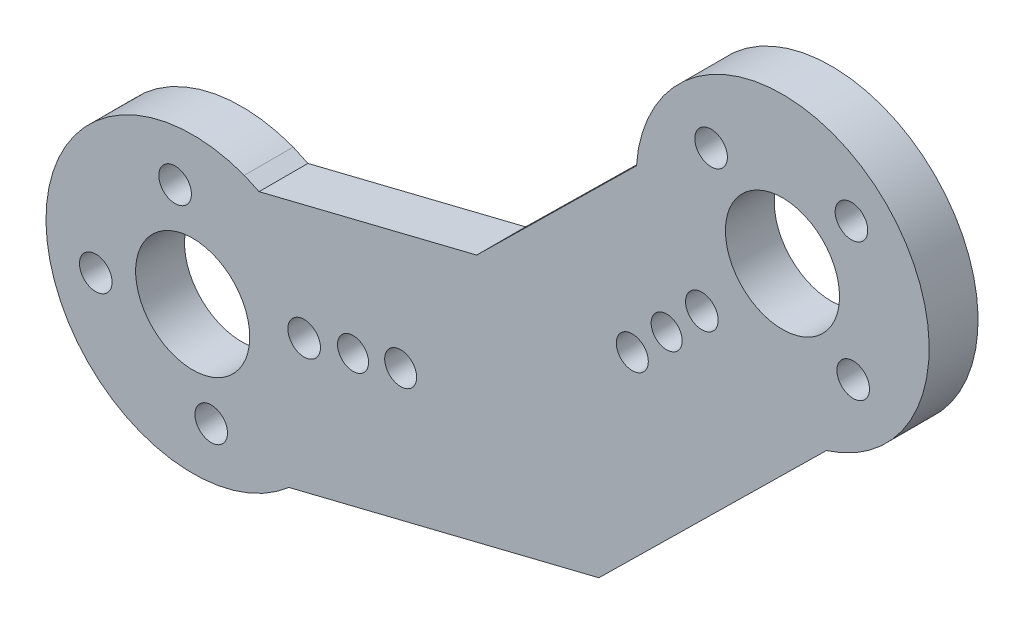
from build123d import *

# Parameters (mm, degrees)
SKETCH1_R       = 1
SKETCH1_R_2     = 3.5
SKETCH1_R_3     = 0.952573724
SKETCH1_R_4     = 0.980307261
EXTRUDE_6_DEPTH = 3


with BuildPart() as part:
    # Sketch1 → Бобышка-Вытянуть6 (new body)
    with BuildSketch(Plane.XY):
        with BuildLine():
            Line((-50.090575528, 20.246358773), (-63.443383911, 16.939772721))
            Line((-63.443383911, 16.939772721), (-64.348156071, 17.355557159))
            ThreePointArc((-64.348156071, 17.355557159), (-76.371742075, 7.335892912), (-61.608311767, 2.139604087))
            Line((-61.608311767, 2.139604087), (-42.594837437, 6.847953613))
            Line((-42.594837437, 6.847953613), (-28.633720832, 20.587239783))
            ThreePointArc((-28.633720832, 20.587239783), (-25.336971544, 35.887296519), (-40.166847554, 30.883790793))
            Line((-40.166847554, 30.883790793), (-40.285943738, 29.895203185))
            Line((-40.285943738, 29.895203185), (-50.090575528, 20.246358773))
        make_face()
        with Locations((-27.098820281, 33.552896146)):
            Circle(SKETCH1_R, mode=Mode.SUBTRACT)
        with Locations((-67.514190904, 8.930818383)):
            Circle(SKETCH1_R_2, mode=Mode.SUBTRACT)
        with Locations((-60.675780867, 10.535905116)):
            Circle(SKETCH1_R, mode=Mode.SUBTRACT)
        with Locations((-66.377650396, 3.14132137)):
            Circle(SKETCH1_R, mode=Mode.SUBTRACT)
        with Locations((-68.59259333, 14.731425956)):
            Circle(SKETCH1_R, mode=Mode.SUBTRACT)
        with Locations((-57.675780867, 11.227745586)):
            Circle(SKETCH1_R_3, mode=Mode.SUBTRACT)
        with Locations((-54.753543693, 11.906369118)):
            Circle(SKETCH1_R_4, mode=Mode.SUBTRACT)
        with Locations((-40.543510307, 19.856172639)):
            Circle(SKETCH1_R_4, mode=Mode.SUBTRACT)
        with Locations((-38.436147278, 21.991359062)):
            Circle(SKETCH1_R_3, mode=Mode.SUBTRACT)
        with Locations((-35.709722432, 33.127748875)):
            Circle(SKETCH1_R, mode=Mode.SUBTRACT)
        with Locations((-26.991820916, 25.175724624)):
            Circle(SKETCH1_R, mode=Mode.SUBTRACT)
        with Locations((-36.27683183, 24.185897745)):
            Circle(SKETCH1_R, mode=Mode.SUBTRACT)
        with Locations((-73.460528059, 7.615837609)):
            Circle(SKETCH1_R, mode=Mode.SUBTRACT)
        with Locations((-31.330827271, 29.173602043)):
            Circle(SKETCH1_R_2, mode=Mode.SUBTRACT)
    extrude(amount=EXTRUDE_6_DEPTH)


solid = part.part
